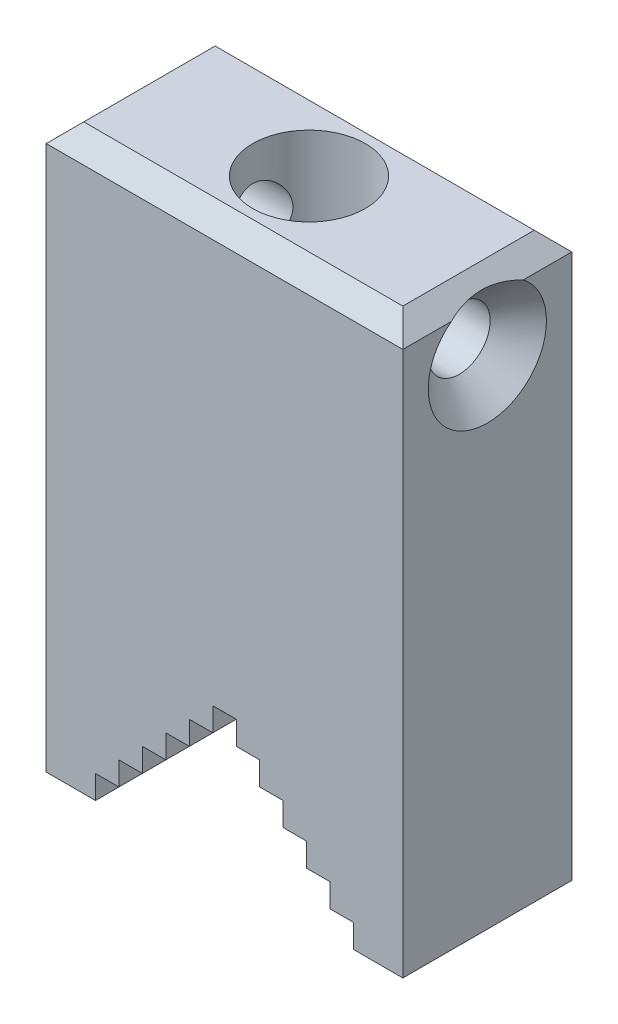
from build123d import *

# Parameters (mm, degrees)
BOSS_EXTRUDE1_DEPTH                             = 9
F_12_0MM_DOWEL_HOLE1_D                          = 12
F_12_0MM_DOWEL_HOLE1_DEPTH                      = 18
F_12_0MM_DOWEL_HOLE1_TIP                        = 3.605163714
CSK_FOR_M6_FLAT_HEAD_MACHINE_SCREW2_D           = 6.6
CSK_FOR_M6_FLAT_HEAD_MACHINE_SCREW2_DEPTH       = 38
CSK_FOR_M6_FLAT_HEAD_MACHINE_SCREW2_CSINK_D     = 12.6
CSK_FOR_M6_FLAT_HEAD_MACHINE_SCREW2_CSINK_ANGLE = 90
CSK_FOR_M6_FLAT_HEAD_MACHINE_SCREW2_TIP         = 1.982840043
CHAMFER1_SIZE                                   = 2


with BuildPart() as part:
    # Sketch1 → Boss-Extrude1 (new, symmetric)
    with BuildSketch(Plane.XY):
        Polygon((19, 60), (-19, 60), (-19, 0), (-13.75, 0), (-13.75, 2.5), (-11.25, 2.5), (-11.25, 5), (-8.75, 5), (-8.75, 7.5), (-6.25, 7.5), (-6.25, 10), (-3.75, 10), (-3.75, 12.5), (-1.25, 12.5), (-1.25, 15), (1.25, 15), (1.25, 12.5), (3.75, 12.5), (3.75, 10), (6.25, 10), (6.25, 7.5), (8.75, 7.5), (8.75, 5), (11.25, 5), (11.25, 2.5), (13.75, 2.5), (13.75, 0), (19, 0), align=None)
    extrude(amount=BOSS_EXTRUDE1_DEPTH, both=True)

    # Ø12.0mm Dowel Hole1
    with Locations(Plane(origin=(0, 60, 0), x_dir=(1, 0, 0), z_dir=(0, 1, 0))):
        with Locations((0, 0)):
            Hole(F_12_0MM_DOWEL_HOLE1_D / 2, depth=F_12_0MM_DOWEL_HOLE1_DEPTH)
            with Locations((0, 0, -(F_12_0MM_DOWEL_HOLE1_DEPTH + F_12_0MM_DOWEL_HOLE1_TIP / 2))):  # 118° drill point
                Cone(0, F_12_0MM_DOWEL_HOLE1_D / 2, F_12_0MM_DOWEL_HOLE1_TIP, mode=Mode.SUBTRACT)

    # CSK for M6 Flat Head Machine Screw2
    with Locations(Plane(origin=(19, 0, 0), x_dir=(0, 0, -1), z_dir=(1, 0, 0))):
        with Locations((0, 53)):
            CounterSinkHole(CSK_FOR_M6_FLAT_HEAD_MACHINE_SCREW2_D / 2, CSK_FOR_M6_FLAT_HEAD_MACHINE_SCREW2_CSINK_D / 2, depth=CSK_FOR_M6_FLAT_HEAD_MACHINE_SCREW2_DEPTH, counter_sink_angle=CSK_FOR_M6_FLAT_HEAD_MACHINE_SCREW2_CSINK_ANGLE)
            with Locations((0, 0, -(CSK_FOR_M6_FLAT_HEAD_MACHINE_SCREW2_DEPTH + CSK_FOR_M6_FLAT_HEAD_MACHINE_SCREW2_TIP / 2))):  # 118° drill point
                Cone(0, CSK_FOR_M6_FLAT_HEAD_MACHINE_SCREW2_D / 2, CSK_FOR_M6_FLAT_HEAD_MACHINE_SCREW2_TIP, mode=Mode.SUBTRACT)

    # Chamfer1
    # the kernel refuses this chamfer: 2 mm, written as the material it takes off along each edge
    with BuildSketch(Plane(origin=(24.143365976, 60, -9), x_dir=(0, 0.027495876610585623, 0.9996219169112968), z_dir=(-1, 0, 0))) as chamfer1_piece_1:
        Polygon((CHAMFER1_SIZE * 0.999621916911, -CHAMFER1_SIZE * 0.0274958766106), (-CHAMFER1_SIZE * 0.0274958766106, -CHAMFER1_SIZE * 0.999621916911), (0, 0), align=None)
    extrude(amount=48.286731952, mode=Mode.SUBTRACT)
    with BuildSketch(Plane(origin=(-19, 60, -14.143365976), x_dir=(-0.027495876610585647, -0.9996219169112968, 0), z_dir=(0, 0, 1)), Plane(origin=(19, 60, -14.143365976), x_dir=(-0.9996219169112968, 0.027495876610585647, 0), z_dir=(0, 0, 1))) as chamfer1_piece_2:
        Polygon((CHAMFER1_SIZE * 0.999621916911, CHAMFER1_SIZE * 0.0274958766106), (-CHAMFER1_SIZE * 0.0274958766106, CHAMFER1_SIZE * 0.999621916911), (0, 0), align=None)
    extrude(amount=28.286731952, mode=Mode.SUBTRACT)
    with BuildSketch(Plane(origin=(24.143365976, 60, 9), x_dir=(0, 0.027495876610585623, -0.9996219169112968), z_dir=(-1, 0, 0))) as chamfer1_piece_3:
        Polygon((CHAMFER1_SIZE * 0.999621916911, CHAMFER1_SIZE * 0.0274958766106), (-CHAMFER1_SIZE * 0.0274958766106, CHAMFER1_SIZE * 0.999621916911), (0, 0), align=None)
    extrude(amount=48.286731952, mode=Mode.SUBTRACT)


solid = part.part
